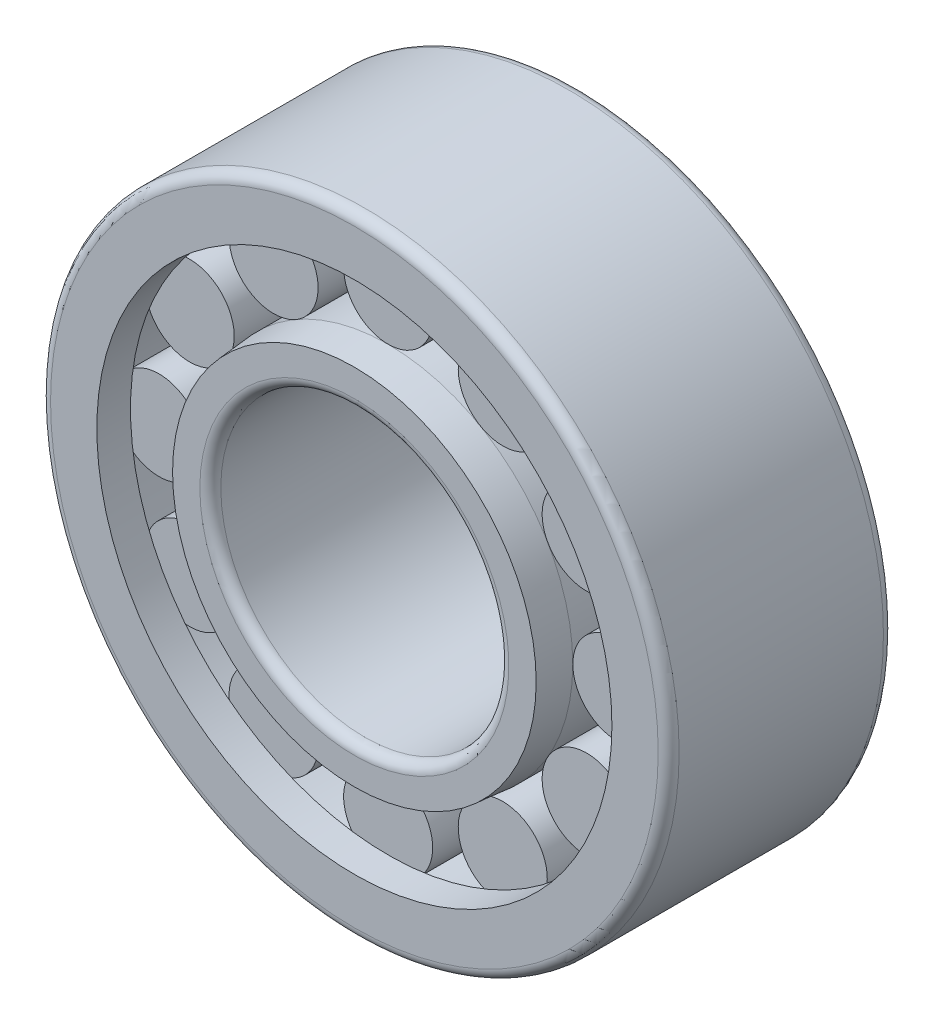
from build123d import *

# Parameters (mm, degrees)
BASESKE_W            = 30.1
BASESKE_H            = 8.5
FILLET1_R            = 2
CIRPATTERNBALL_COUNT = 12


with BuildPart() as part:
    # BaseSke → Roller (revolve)
    with BuildSketch(Plane(origin=(0, 0, 0), x_dir=(0, 0, -1), z_dir=(1, 0, 0))):
        with Locations((0, 39.5)):
            Rectangle(BASESKE_W, BASESKE_H)
    roller = revolve(axis=Axis((0, 43.75, 15.05), (0, 0, -1)))

    # OuterRaceSke → OuterRace (revolve)
    with BuildSketch(Plane(origin=(0, 0, 0), x_dir=(0, 0, -1), z_dir=(1, 0, 0))):
        Polygon((-21.5, 60), (21.5, 60), (21.5, 49.166666667), (15.075, 49.166666667), (15.075, 52.23), (-15.075, 52.23), (-15.075, 49.166666667), (-21.5, 49.166666667), align=None)
    revolve(axis=Axis((0, 0, 50.391616343), (0, 0, -1)))

    # InnerRaceSke → InnerRace (revolve)
    with BuildSketch(Plane(origin=(0, 0, 0), x_dir=(0, 0, -1), z_dir=(1, 0, 0))):
        Polygon((-21.5, 27.5), (21.5, 27.5), (21.5, 38.333333333), (15.075, 38.333333333), (15.075, 35.27), (-15.075, 35.27), (-15.075, 38.333333333), (-21.5, 38.333333333), align=None)
    revolve(axis=Axis((0, 0, 70.862590906), (0, 0, -1)))

    # Fillet1
    fillet1_edges = [part.edges().sort_by_distance(p)[0] for p in [
        (0, -27.5, 21.5),
        (0, -60, -21.5),
        (0, -60, 21.5),
        (0, -27.5, -21.5),
    ]]
    fillet(fillet1_edges, radius=FILLET1_R)

    # NJSke → NJ (revolve, cut)
    with BuildSketch(Plane(origin=(0, 0, 0), x_dir=(0, 0, -1), z_dir=(1, 0, 0))):
        Polygon((21.5, 38.333333333), (15.075, 38.333333333), (15.075, 35.27), (21.5, 34.707885337), align=None)
    nj = revolve(axis=Axis((0, 0, 35.607790457), (0, 0, -1)), mode=Mode.SUBTRACT)

    # NU: NJ across plane
    add(nj.mirror(Plane.XY), mode=Mode.SUBTRACT)

    # CirPatternBall: Roller ×12 about axis
    cirpatternball_axis = Axis((0, 0, 50.391616343), (0, 0, -1))
    for i in range(1, CIRPATTERNBALL_COUNT):
        add(roller.rotate(cirpatternball_axis, i * 360 / CIRPATTERNBALL_COUNT))


solid = part.part
